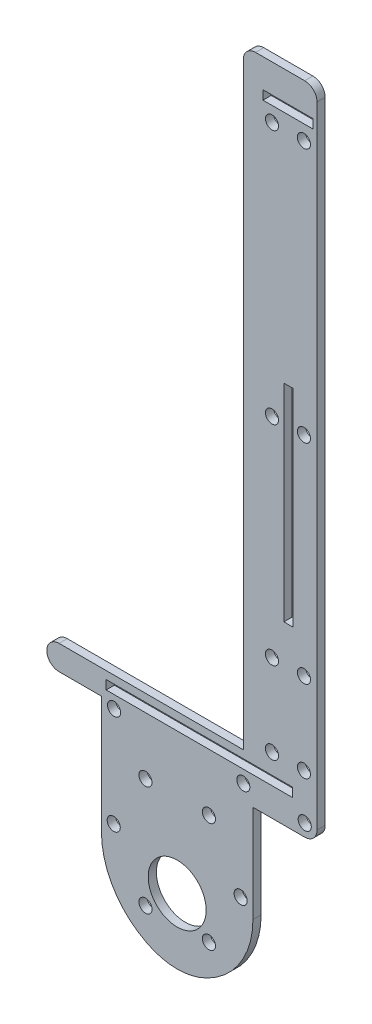
from build123d import *

# Parameters (mm, degrees)
SKETCH_1_R          = 1.6
SKETCH_1_W          = 45.5
SKETCH_1_H          = 2.2
SKETCH_1_W_2        = 2.2
SKETCH_1_H_2        = 50.5
SKETCH_1_W_3        = 12.2
SKETCH_1_R_2        = 7.08
EXTRUDE_1_DEPTH     = 2
SKETCH_2_W          = 4
SKETCH_2_H          = 160
CUT_EXTRUDE_1_DEPTH = 10
SKETCH_3_R          = 1.6
CUT_EXTRUDE_2_DEPTH = 10
FILLET_1_R          = 3


with BuildPart() as part:
    # 草图1 → 凸台-拉伸1 (new body)
    with BuildSketch(Plane.XY):
        with BuildLine():
            Line((-8.65326359, -109.246690295), (-8.65326359, -85.5))
            Line((-8.65326359, -85.5), (11, -85.5))
            Line((11, -85.5), (11, 74.5))
            Line((11, 74.5), (-11, 74.5))
            Line((-11, 74.5), (-11, -74.5))
            Line((-11, -74.5), (-59, -74.5))
            Line((-59, -74.5), (-59, -80.5))
            Line((-59, -80.5), (-45.65326359, -80.5))
            Line((-45.65326359, -80.5), (-45.65326359, -109.246690295))
            ThreePointArc((-45.65326359, -109.246690295), (-42.686252119, -119.728927736), (-34.665533413, -127.101073304))
            Line((-34.665533413, -127.101073304), (-34.351105887, -127.259785353))
            ThreePointArc((-34.351105887, -127.259785353), (-27.15326359, -128.973428312), (-19.955421292, -127.259785353))
            Line((-19.955421292, -127.259785353), (-19.640993767, -127.101073304))
            ThreePointArc((-19.640993767, -127.101073304), (-11.620275061, -119.728927736), (-8.65326359, -109.246690295))
        make_face()
        with Locations((-11, -81.629391896)):
            Circle(SKETCH_1_R, mode=Mode.SUBTRACT)
        with Locations((-42.570682945, -81.629391896)):
            Circle(SKETCH_1_R, mode=Mode.SUBTRACT)
        with Locations((-42.65326359, -106)):
            Circle(SKETCH_1_R, mode=Mode.SUBTRACT)
        with Locations((-34.90326359, -92.576606241)):
            Circle(SKETCH_1_R, mode=Mode.SUBTRACT)
        with Locations((-19.40326359, -92.576606241)):
            Circle(SKETCH_1_R, mode=Mode.SUBTRACT)
        with Locations((-11.65326359, -106)):
            Circle(SKETCH_1_R, mode=Mode.SUBTRACT)
        with Locations((-19.40326359, -119.423393759)):
            Circle(SKETCH_1_R, mode=Mode.SUBTRACT)
        with Locations((-34.90326359, -119.423393759)):
            Circle(SKETCH_1_R, mode=Mode.SUBTRACT)
        with Locations((-21.75, -77.5)):
            Rectangle(SKETCH_1_W, SKETCH_1_H, mode=Mode.SUBTRACT)
        with Locations((3.8, 61.7)):
            Circle(SKETCH_1_R, mode=Mode.SUBTRACT)
        with Locations((-4, -71.5)):
            Circle(SKETCH_1_R, mode=Mode.SUBTRACT)
        with Locations((3.8, -71.5)):
            Circle(SKETCH_1_R, mode=Mode.SUBTRACT)
        with Locations((-4, -51.5)):
            Circle(SKETCH_1_R, mode=Mode.SUBTRACT)
        with Locations((3.8, -51.5)):
            Circle(SKETCH_1_R, mode=Mode.SUBTRACT)
        with Locations((0, -17.25)):
            Rectangle(SKETCH_1_W_2, SKETCH_1_H_2, mode=Mode.SUBTRACT)
        with Locations((-4, -0.5)):
            Circle(SKETCH_1_R, mode=Mode.SUBTRACT)
        with Locations((3.8, -0.5)):
            Circle(SKETCH_1_R, mode=Mode.SUBTRACT)
        with Locations((-4, 61.7)):
            Circle(SKETCH_1_R, mode=Mode.SUBTRACT)
        with Locations((-0.1, 66.4)):
            Rectangle(SKETCH_1_W_3, SKETCH_1_H, mode=Mode.SUBTRACT)
        with Locations((-27.15326359, -113)):
            Circle(SKETCH_1_R_2, mode=Mode.SUBTRACT)
    extrude(amount=EXTRUDE_1_DEPTH)

    # 草图2 → 切除-拉伸1 (cut)
    with BuildSketch(Plane(origin=(0, 0, 0), x_dir=(-1, 0, 0), z_dir=(0, 0, -1))):
        with Locations((-9, -5.5)):
            Rectangle(SKETCH_2_W, SKETCH_2_H)
    extrude(amount=-CUT_EXTRUDE_1_DEPTH, mode=Mode.SUBTRACT)

    # 草图3 → 切除-拉伸2 (cut)
    with BuildSketch(Plane(origin=(0, 0, 0), x_dir=(-1, 0, 0), z_dir=(0, 0, -1))):
        with Locations((-4, -82.5)):
            Circle(SKETCH_3_R)
    extrude(amount=-CUT_EXTRUDE_2_DEPTH, mode=Mode.SUBTRACT)

    # 圆角1
    fillet_1_edges = [part.edges().sort_by_distance(p)[0] for p in [
        (7, 74.5, 1),
        (-11, 74.5, 1),
        (-59, -74.5, 1),
        (-59, -80.5, 1),
        (7, -85.5, 1),
    ]]
    fillet(fillet_1_edges, radius=FILLET_1_R - 0.0001)  # a hair under: the kernel refuses the full size


solid = part.part
